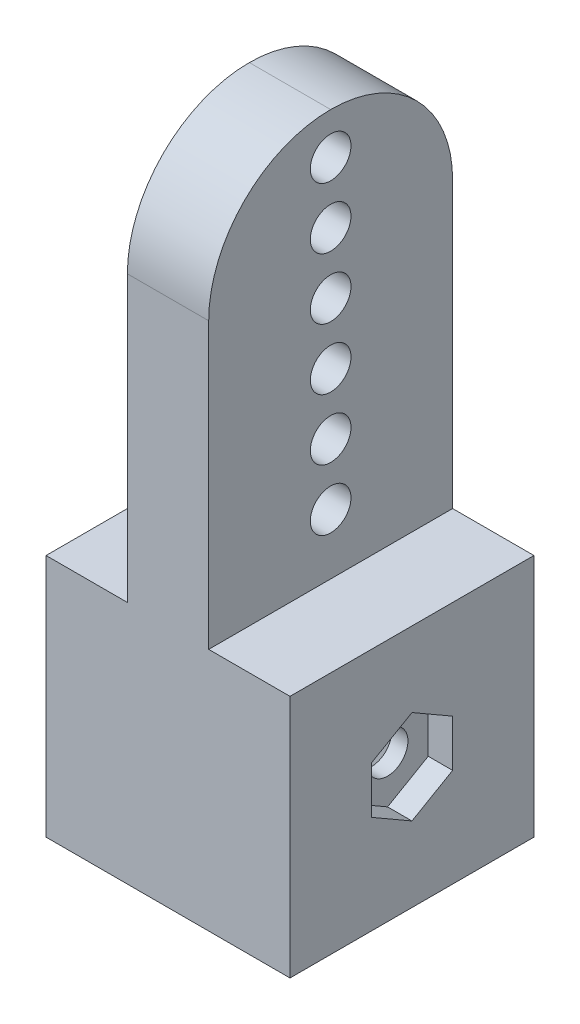
from build123d import *

# Parameters (mm, degrees)
SKETCH1_W           = 30
SKETCH1_H           = 30
SKETCH1_W_2         = 20
SKETCH1_H_2         = 20
BOSS_EXTRUDE1_DEPTH = 20
BOSS_EXTRUDE2_START = 20
SKETCH1_2_W         = 30
SKETCH1_2_H         = 30
SKETCH1_2_W_2       = 20
SKETCH1_2_H_2       = 20
BOSS_EXTRUDE2_DEPTH = 10
SKETCH3_R           = 2.5
CUT_EXTRUDE1_DEPTH  = 46
SKETCH3_3_R         = 4
SKETCH3_3_R_2       = 2.5
CUT_EXTRUDE2_DEPTH  = 3
CUT_EXTRUDE3_START  = -27
SKETCH3_4_R         = 4
SKETCH3_4_R_2       = 2.5
CUT_EXTRUDE3_DEPTH  = 3
SKETCH4_W           = 10
SKETCH4_H           = 30
BOSS_EXTRUDE3_DEPTH = 50
SKETCH5_R           = 2.5
CUT_EXTRUDE4_DEPTH  = 84.815273071
LPATTERN1_COUNT     = 6
LPATTERN1_PITCH     = 7.5
FILLET1_R           = 15


with BuildPart() as part:
    # Sketch1 → Boss-Extrude1 (new body)
    with BuildSketch(Plane(origin=(0, 0, 0), x_dir=(1, 0, 0), z_dir=(0, 1, 0))):
        Rectangle(SKETCH1_W, SKETCH1_H)
        Rectangle(SKETCH1_W_2, SKETCH1_H_2, mode=Mode.SUBTRACT)
    extrude(amount=BOSS_EXTRUDE1_DEPTH)

    # Sketch1<2> → Boss-Extrude2 (add)
    # profile 1 of 2: a face of its own
    with BuildSketch(Plane(origin=(0, 0, 0), x_dir=(1, 0, 0), z_dir=(0, 1, 0)).offset(BOSS_EXTRUDE2_START)):
        Rectangle(SKETCH1_2_W, SKETCH1_2_H)
        Rectangle(SKETCH1_2_W_2, SKETCH1_2_H_2, mode=Mode.SUBTRACT)
    # profile 2 of 2: a face of its own
    with BuildSketch(Plane(origin=(0, 0, 0), x_dir=(1, 0, 0), z_dir=(0, 1, 0)).offset(BOSS_EXTRUDE2_START)):
        Rectangle(SKETCH1_2_W_2, SKETCH1_2_H_2)
    extrude(amount=BOSS_EXTRUDE2_DEPTH)

    # Sketch3 → Cut-Extrude1 (cut, through all)
    with BuildSketch(Plane(origin=(15, 0, 0), x_dir=(0, 0, -1), z_dir=(1, 0, 0))):
        with Locations((0, 15)):
            Circle(SKETCH3_R)
    extrude(amount=-CUT_EXTRUDE1_DEPTH, mode=Mode.SUBTRACT)

    # Sketch3<3> → Cut-Extrude2 (cut)
    # profile 1 of 2: a face of its own
    with BuildSketch(Plane(origin=(15, 0, 0), x_dir=(0, 0, -1), z_dir=(1, 0, 0))):
        Polygon((-5, 17.886751346), (-5, 12.113248654), (0, 9.226497308), (5, 12.113248654), (5, 17.886751346), (0, 20.773502692), align=None)
        with Locations((0, 15)):
            Circle(SKETCH3_3_R, mode=Mode.SUBTRACT)
    # profile 2 of 2: a face of its own
    with BuildSketch(Plane(origin=(15, 0, 0), x_dir=(0, 0, -1), z_dir=(1, 0, 0))):
        with Locations((0, 15)):
            Circle(SKETCH3_3_R)
        with Locations((0, 15)):
            Circle(SKETCH3_3_R_2, mode=Mode.SUBTRACT)
    extrude(amount=-CUT_EXTRUDE2_DEPTH, mode=Mode.SUBTRACT)

    # Sketch3<4> → Cut-Extrude3 (cut)
    with BuildSketch(Plane(origin=(15, 0, 0), x_dir=(0, 0, -1), z_dir=(1, 0, 0)).offset(CUT_EXTRUDE3_START)):
        with Locations((0, 15)):
            Circle(SKETCH3_4_R)
        with Locations((0, 15)):
            Circle(SKETCH3_4_R_2, mode=Mode.SUBTRACT)
    extrude(amount=-CUT_EXTRUDE3_DEPTH, mode=Mode.SUBTRACT)

    # Sketch4 → Boss-Extrude3 (add)
    with BuildSketch(Plane(origin=(0, 30, 0), x_dir=(1, 0, 0), z_dir=(0, 1, 0))):
        Rectangle(SKETCH4_W, SKETCH4_H)
    extrude(amount=BOSS_EXTRUDE3_DEPTH)

    # Sketch5 → Cut-Extrude4 (cut, through all)
    with BuildSketch(Plane(origin=(5, 0, 0), x_dir=(0, 0, -1), z_dir=(1, 0, 0))):
        with Locations((0, 37.407153601)):
            Circle(SKETCH5_R)
    cut_extrude4 = extrude(amount=-CUT_EXTRUDE4_DEPTH, mode=Mode.SUBTRACT)

    # LPattern1: Cut-Extrude4 ×6
    with Locations(*[(0, i * LPATTERN1_PITCH, 0) for i in range(1, LPATTERN1_COUNT)]):
        add(cut_extrude4, mode=Mode.SUBTRACT)

    # Fillet1
    fillet1_edges = [part.edges().sort_by_distance(p)[0] for p in [
        (0, 80, -15),
        (0, 80, 15),
    ]]
    fillet(fillet1_edges, radius=FILLET1_R - 0.0001)  # a hair under: the kernel refuses the full size


solid = part.part
